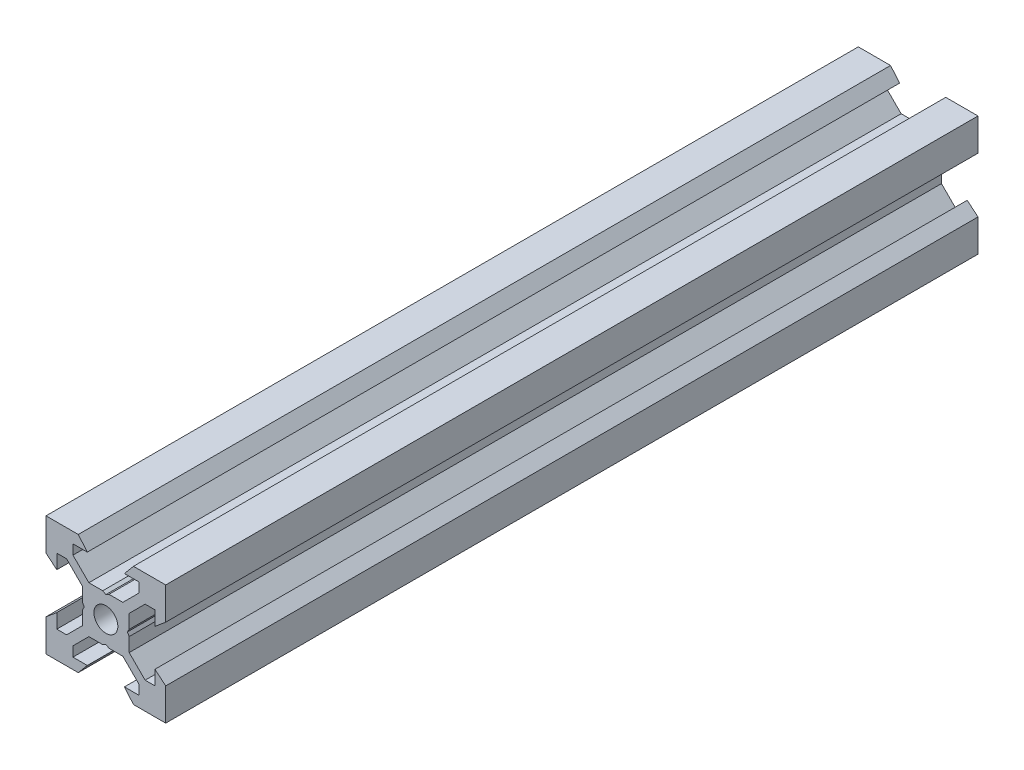
from build123d import *

# Parameters (mm, degrees)
SKETCH1_R           = 2
BOSS_EXTRUDE1_DEPTH = 67.855


with BuildPart() as part:
    # Sketch1 → Boss-Extrude1 (new, symmetric)
    with BuildSketch(Plane.XY):
        Polygon((10, 4.610379336), (10, 10), (4.610379336, 10), (3.1, 8.2), (5.5, 8.2), (5.5, 6.560660172), (2.839339828, 3.9), (0.519615242, 3.9), (0, 3.6), (-0.519615242, 3.9), (-2.839339828, 3.9), (-5.5, 6.560660172), (-5.5, 8.2), (-3.1, 8.2), (-4.610379336, 10), (-10, 10), (-10, 4.610379336), (-8.2, 3.1), (-8.2, 5.5), (-6.560660172, 5.5), (-3.9, 2.839339828), (-3.9, 0.519615242), (-3.6, 0), (-3.9, -0.519615242), (-3.9, -2.839339828), (-6.560660172, -5.5), (-8.2, -5.5), (-8.2, -3.1), (-10, -4.610379336), (-10, -10), (-4.610379336, -10), (-3.1, -8.2), (-5.5, -8.2), (-5.5, -6.560660172), (-2.839339828, -3.9), (-0.519615242, -3.9), (0, -3.6), (0.519615242, -3.9), (2.839339828, -3.9), (5.5, -6.560660172), (5.5, -8.2), (3.1, -8.2), (4.610379336, -10), (10, -10), (10, -4.610379336), (8.2, -3.1), (8.2, -5.5), (6.560660172, -5.5), (3.9, -2.839339828), (3.9, -0.519615242), (3.6, 0), (3.9, 0.519615242), (3.9, 2.839339828), (6.560660172, 5.5), (8.2, 5.5), (8.2, 3.1), align=None)
        Circle(SKETCH1_R, mode=Mode.SUBTRACT)
    extrude(amount=BOSS_EXTRUDE1_DEPTH, both=True)


solid = part.part
